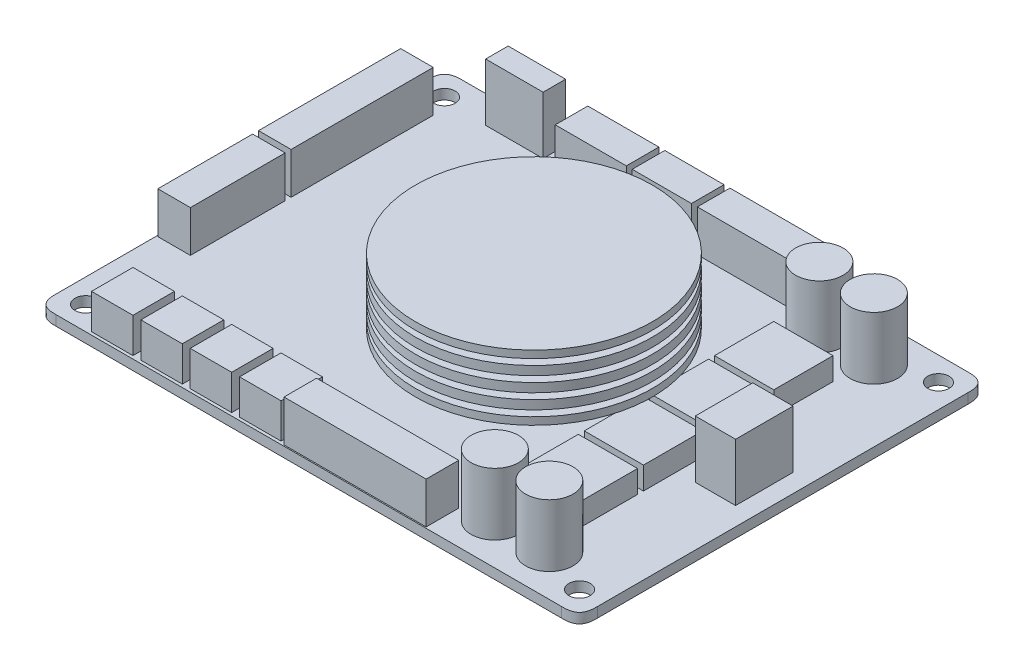
from build123d import *

# Parameters (mm, degrees)
SKETCH1_W                = 91.4
SKETCH1_H                = 68.6
BOSS_EXTRUDE1_DEPTH      = 1.7
BOSS_EXTRUDE2_START      = 4
SKETCH2_R                = 20
BOSS_EXTRUDE2_DEPTH      = 11
SKETCH3_R                = 4
BOSS_EXTRUDE3_DEPTH      = 10.5
SKETCH4_W                = 10
SKETCH4_H                = 10
BOSS_EXTRUDE4_DEPTH      = 3.8
SKETCH6_R                = 10
BOSS_EXTRUDE5_DEPTH      = 15
SKETCH7_W                = 6.8
SKETCH7_H                = 9.7
SKETCH7_W_2              = 9.7
SKETCH7_H_2              = 3.8
BOSS_EXTRUDE6_DEPTH      = 9.7
SKETCH8_W                = 24
SKETCH8_H                = 5.5
SKETCH8_W_2              = 5.5
SKETCH8_H_2              = 24
SKETCH8_H_3              = 16
SKETCH8_W_3              = 12
SKETCH8_W_4              = 10
SKETCH8_W_5              = 16
BOSS_EXTRUDE7_DEPTH      = 7
SKETCH9_W                = 7
SKETCH9_H                = 7
BOSS_EXTRUDE8_DEPTH      = 5.9
M3_CLEARANCE_HOLE1_D     = 3.6
M3_CLEARANCE_HOLE1_DEPTH = 7.5
M3_CLEARANCE_HOLE1_TIP   = 1.081549114
FILLET1_SIZE             = 3
CUT_EXTRUDE1_START       = -2.25
SKETCH12_R               = 20
SKETCH12_R_2             = 18
CUT_EXTRUDE1_DEPTH       = 1
LPATTERN1_COUNT          = 4
LPATTERN1_PITCH          = 2.5


with BuildPart() as part:
    # Sketch1 → Boss-Extrude1 (new body)
    with BuildSketch(Plane(origin=(0, 0, 0), x_dir=(1, 0, 0), z_dir=(0, 1, 0))):
        Rectangle(SKETCH1_W, SKETCH1_H)
    extrude(amount=BOSS_EXTRUDE1_DEPTH)

    # Sketch3 → Boss-Extrude3 (add)
    with BuildSketch(Plane(origin=(0, 1.7, 0), x_dir=(1, 0, 0), z_dir=(0, 1, 0))):
        with Locations(Location((24.5, 27.4, 0), (0, 0, 90))):
            Circle(SKETCH3_R)
        with Locations(Location((33.7, 27.4, 0), (0, 0, 90))):
            Circle(SKETCH3_R)
        with Locations(Location((33.7, -27.4, 0), (0, 0, 90))):
            Circle(SKETCH3_R)
        with Locations(Location((24.5, -27.4, 0), (0, 0, 90))):
            Circle(SKETCH3_R)
    extrude(amount=BOSS_EXTRUDE3_DEPTH)

    # Sketch4 → Boss-Extrude4 (add)
    with BuildSketch(Plane(origin=(0, 1.7, 0), x_dir=(1, 0, 0), z_dir=(0, 1, 0))):
        with Locations((27.7, 5.5)):
            Rectangle(SKETCH4_W, SKETCH4_H)
        with Locations((27.7, 16.5)):
            Rectangle(SKETCH4_W, SKETCH4_H)
        with Locations((27.7, -5.5)):
            Rectangle(SKETCH4_W, SKETCH4_H)
        with Locations((27.7, -16.5)):
            Rectangle(SKETCH4_W, SKETCH4_H)
    extrude(amount=BOSS_EXTRUDE4_DEPTH)



with BuildPart() as body_2:
    # Sketch2 → Boss-Extrude2 (new body)
    with BuildSketch(Plane(origin=(0, 1.7, 0), x_dir=(1, 0, 0), z_dir=(0, 1, 0)).offset(BOSS_EXTRUDE2_START)):
        with Locations(Location((3.7, 0, 0), (0, 0, 270))):
            Circle(SKETCH2_R)
    extrude(amount=BOSS_EXTRUDE2_DEPTH)


with BuildPart() as part_1:
    add(part.part)

    add(body_2.part)  # Boss-Extrude5 merges body 2
    # Sketch6 → Boss-Extrude5 (add)
    with BuildSketch(Plane(origin=(0, 16.7, 0), x_dir=(1, 0, 0), z_dir=(0, 1, 0))):
        with Locations(Location((3.7, 0, 0), (0, 0, 270))):
            Circle(SKETCH6_R)
    extrude(amount=-BOSS_EXTRUDE5_DEPTH)

    # Sketch7 → Boss-Extrude6 (add)
    with BuildSketch(Plane(origin=(0, 1.7, 0), x_dir=(1, 0, 0), z_dir=(0, 1, 0))):
        with Locations((39.2, 0)):
            Rectangle(SKETCH7_W, SKETCH7_H)
        with Locations((-29.25, 31.55)):
            Rectangle(SKETCH7_W_2, SKETCH7_H_2)
    extrude(amount=BOSS_EXTRUDE6_DEPTH)

    # Sketch8 → Boss-Extrude7 (add)
    with BuildSketch(Plane(origin=(0, 1.7, 0), x_dir=(1, 0, 0), z_dir=(0, 1, 0))):
        with Locations((7.6, -31.35)):
            Rectangle(SKETCH8_W, SKETCH8_H)
        with Locations((-42.75, 14.7)):
            Rectangle(SKETCH8_W_2, SKETCH8_H_2)
        with Locations((-42.75, -6.3)):
            Rectangle(SKETCH8_W_2, SKETCH8_H_3)
        with Locations((-15.3, 31.35)):
            Rectangle(SKETCH8_W_3, SKETCH8_H)
        with Locations((-3.3, 31.35)):
            Rectangle(SKETCH8_W_4, SKETCH8_H)
        with Locations((10.7, 31.35)):
            Rectangle(SKETCH8_W_5, SKETCH8_H)
    extrude(amount=BOSS_EXTRUDE7_DEPTH)

    # Sketch9 → Boss-Extrude8 (add)
    with BuildSketch(Plane(origin=(0, 1.7, 0), x_dir=(1, 0, 0), z_dir=(0, 1, 0))):
        with Locations((-33.7, -30.3)):
            Rectangle(SKETCH9_W, SKETCH9_H)
        with Locations((-25.366666667, -30.3)):
            Rectangle(SKETCH9_W, SKETCH9_H)
        with Locations((-17.033333333, -30.3)):
            Rectangle(SKETCH9_W, SKETCH9_H)
        with Locations((-8.7, -30.3)):
            Rectangle(SKETCH9_W, SKETCH9_H)
    extrude(amount=BOSS_EXTRUDE8_DEPTH)

    # M3 Clearance Hole1
    with Locations(Plane(origin=(0, 1.7, 0), x_dir=(1, 0, 0), z_dir=(0, 1, 0))):
        with Locations((41.7, 30.3), (-41.7, -30.3), (41.7, -30.3), (-41.7, 30.3)):
            Hole(M3_CLEARANCE_HOLE1_D / 2, depth=M3_CLEARANCE_HOLE1_DEPTH)
            with Locations((0, 0, -(M3_CLEARANCE_HOLE1_DEPTH + M3_CLEARANCE_HOLE1_TIP / 2))):  # 118° drill point
                Cone(0, M3_CLEARANCE_HOLE1_D / 2, M3_CLEARANCE_HOLE1_TIP, mode=Mode.SUBTRACT)

    # Fillet1
    # a fillet whose section is not a circle: 3 mm, written as the material it takes off along each edge
    with BuildSketch(Plane(origin=(-45.7, -7.5, 34.3), x_dir=(1, 0, 0), z_dir=(0, 1, 0)), Plane(origin=(-45.7, -7.5, -34.3), x_dir=(0, 0, 1), z_dir=(0, 1, 0))) as fillet1_piece_1:
        with BuildLine():
            add(Edge.make_bspline([(FILLET1_SIZE, 0), (FILLET1_SIZE * 0.831801948466, 0), (FILLET1_SIZE * 0.663603896932, 0), (FILLET1_SIZE * 0.292893218813, FILLET1_SIZE * 0.0716919198361), (FILLET1_SIZE * 0.0716919198361, FILLET1_SIZE * 0.292893218813), (0, FILLET1_SIZE * 0.663603896932), (0, FILLET1_SIZE * 0.831801948466), (0, FILLET1_SIZE)], knots=[0, 0, 0, 0, 0, 0, 0.5, 0.5, 1, 1, 1, 1, 1, 1], degree=5))
            Line((0, FILLET1_SIZE), (0, 0))
            Line((0, 0), (FILLET1_SIZE, 0))
        make_face()
    extrude(amount=16.7, mode=Mode.SUBTRACT)
    with BuildSketch(Plane(origin=(45.7, -7.5, -34.3), x_dir=(0, 0, 1), z_dir=(0, 1, 0)), Plane(origin=(45.7, -7.5, 34.3), x_dir=(-1, 0, 0), z_dir=(0, 1, 0))) as fillet1_piece_2:
        with BuildLine():
            add(Edge.make_bspline([(FILLET1_SIZE, 0), (FILLET1_SIZE * 0.831801948466, 0), (FILLET1_SIZE * 0.663603896932, 0), (FILLET1_SIZE * 0.292893218813, -FILLET1_SIZE * 0.0716919198361), (FILLET1_SIZE * 0.0716919198361, -FILLET1_SIZE * 0.292893218813), (0, -FILLET1_SIZE * 0.663603896932), (0, -FILLET1_SIZE * 0.831801948466), (0, -FILLET1_SIZE)], knots=[0, 0, 0, 0, 0, 0, 0.5, 0.5, 1, 1, 1, 1, 1, 1], degree=5))
            Line((0, -FILLET1_SIZE), (0, 0))
            Line((0, 0), (FILLET1_SIZE, 0))
        make_face()
    extrude(amount=16.7, mode=Mode.SUBTRACT)

    # Sketch12 → Cut-Extrude1 (cut)
    with BuildSketch(Plane(origin=(0, 16.7, 0), x_dir=(1, 0, 0), z_dir=(0, 1, 0)).offset(CUT_EXTRUDE1_START)):
        with Locations(Location((3.7, 0, 0), (0, 0, 270))):
            Circle(SKETCH12_R)
        with Locations(Location((3.7, 0, 0), (0, 0, 270))):
            Circle(SKETCH12_R_2, mode=Mode.SUBTRACT)
    cut_extrude1 = extrude(amount=CUT_EXTRUDE1_DEPTH, mode=Mode.SUBTRACT)

    # LPattern1: Cut-Extrude1 ×4
    with Locations(*[(0, -i * LPATTERN1_PITCH, 0) for i in range(1, LPATTERN1_COUNT)]):
        add(cut_extrude1, mode=Mode.SUBTRACT)


solid = part_1.part
